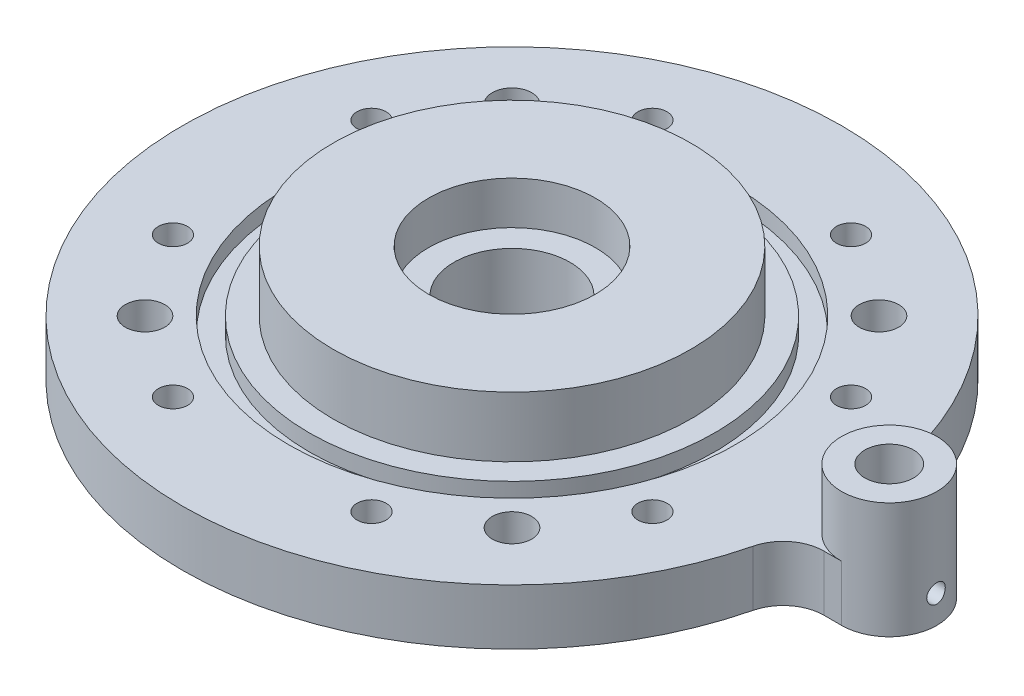
from build123d import *

# Parameters (mm, degrees)
BASE_DEPTH                       = 9.525
SKETCH3_R                        = 3.373437
SKETCH3_R_2                      = 3.373438
SQUARE_BOLT_HOLES_DEPTH          = 93.60072
SKETCH4_R                        = 2.5
HOUSING_BOLTS_DEPTH              = 44.33
CIRPATTERN1_COUNT                = 8
SKETCH2_R                        = 30.626685
SKETCH2_R_2                      = 8.167188
SKETCH2_R_3                      = 4.167187
IMPELLER_CAVITY_RISER_DEPTH      = 10.34225
SKETCH5_R                        = 14.2875
SEAL_BORE_DEPTH                  = 7.35
SKETCH6_R                        = 9.9375
BORE_DEPTH                       = 39.3
PRESSURE_TAP_DEPTH               = 128.779968
PRESSURE_TAP_DEPTH_BACK          = 56.45
SKETCH9_R                        = 1.5875
SKETCH10_R                       = 1.5875
PRESSURE_TAP_VERTICAL_HOLE_DEPTH = 6.35
SKETCH12_R                       = 38.2524
SKETCH12_R_2                     = 34.7218
CUT_EXTRUDE1_DEPTH               = 2.82448


with BuildPart() as part:
    # Sketch1 → base (new body)
    with BuildSketch(Plane(origin=(0, 0, 0), x_dir=(1, 0, 0), z_dir=(0, 1, 0))):
        with BuildLine():
            Line((61.610542, 8.167188), (64.617188, 8.167188))
            ThreePointArc((64.617188, 8.167188), (72.784375, 0), (64.617188, -8.167188))
            Line((64.617188, -8.167188), (61.610542, -8.167188))
            ThreePointArc((61.610542, -8.167188), (57.292732, -9.657513), (54.813477, -13.493897))
            ThreePointArc((54.813477, -13.493897), (-56.45, 0), (54.813477, 13.493897))
            ThreePointArc((54.813477, 13.493897), (57.292732, 9.657513), (61.610542, 8.167188))
        make_face()
    extrude(amount=BASE_DEPTH)

    # Sketch3 → square bolt holes (cut, through all)
    with BuildSketch(Plane.XZ):
        with Locations((-31.430896, -31.430896)):
            Circle(SKETCH3_R)
        with Locations((-31.430896, 31.430896)):
            Circle(SKETCH3_R)
        with Locations((31.430896, 31.430896)):
            Circle(SKETCH3_R_2)
        with Locations((31.430896, -31.430896)):
            Circle(SKETCH3_R_2)
    extrude(amount=-SQUARE_BOLT_HOLES_DEPTH, mode=Mode.SUBTRACT)

    # Sketch4 → housing bolts (cut)
    with BuildSketch(Plane(origin=(0, 9.525, 0), x_dir=(1, 0, 0), z_dir=(0, 1, 0))):
        with Locations((17.010279, 41.066445)):
            Circle(SKETCH4_R)
    housing_bolts = extrude(amount=-HOUSING_BOLTS_DEPTH, mode=Mode.SUBTRACT)

    # CirPattern1: housing bolts ×8 about axis
    cirpattern1_axis = Axis((0, 9.525, 0), (0, 1, 0))
    for i in range(1, CIRPATTERN1_COUNT):
        add(housing_bolts.rotate(cirpattern1_axis, i * 360 / CIRPATTERN1_COUNT), mode=Mode.SUBTRACT)

    # Sketch2 → impeller cavity riser (add)
    # profile 1 of 2: a face of its own
    with BuildSketch(Plane(origin=(0, 9.525, 0), x_dir=(1, 0, 0), z_dir=(0, 1, 0))):
        Circle(SKETCH2_R)
    # profile 2 of 2: a face of its own
    with BuildSketch(Plane(origin=(0, 9.525, 0), x_dir=(1, 0, 0), z_dir=(0, 1, 0))):
        with Locations((64.617188, 0)):
            Circle(SKETCH2_R_2)
        with Locations((64.617188, 0)):
            Circle(SKETCH2_R_3, mode=Mode.SUBTRACT)
    extrude(amount=IMPELLER_CAVITY_RISER_DEPTH)

    # Sketch5 → seal bore (cut)
    with BuildSketch(Plane(origin=(0, 19.86725, 0), x_dir=(1, 0, 0), z_dir=(0, 1, 0))):
        Circle(SKETCH5_R)
    extrude(amount=-SEAL_BORE_DEPTH, mode=Mode.SUBTRACT)

    # Sketch6 → bore (cut)
    with BuildSketch(Plane(origin=(0, 12.51725, 0), x_dir=(1, 0, 0), z_dir=(0, 1, 0))):
        Circle(SKETCH6_R)
    extrude(amount=-BORE_DEPTH, mode=Mode.SUBTRACT)

    # Sketch9 → pressure tap (cut, two sides: drawn at the far end of the back side and taken through both)
    with BuildSketch(Plane(origin=(56.45, 0, 0), x_dir=(0, 0, -1), z_dir=(1, 0, 0)).offset(-PRESSURE_TAP_DEPTH_BACK)):
        with Locations((0, 4.7625)):
            Circle(SKETCH9_R)
    extrude(amount=PRESSURE_TAP_DEPTH + PRESSURE_TAP_DEPTH_BACK, mode=Mode.SUBTRACT)

    # Sketch10 → pressure tap vertical hole (cut)
    with BuildSketch(Plane(origin=(0, 9.525, 0), x_dir=(1, 0, 0), z_dir=(0, 1, 0))):
        with Locations((64.617188, 0)):
            Circle(SKETCH10_R)
    extrude(amount=-PRESSURE_TAP_VERTICAL_HOLE_DEPTH, mode=Mode.SUBTRACT)

    # Sketch12 → Cut-Extrude1 (cut)
    with BuildSketch(Plane(origin=(0, 9.525, 0), x_dir=(1, 0, 0), z_dir=(0, 1, 0))):
        Circle(SKETCH12_R)
        Circle(SKETCH12_R_2, mode=Mode.SUBTRACT)
    extrude(amount=-CUT_EXTRUDE1_DEPTH, mode=Mode.SUBTRACT)


solid = part.part
